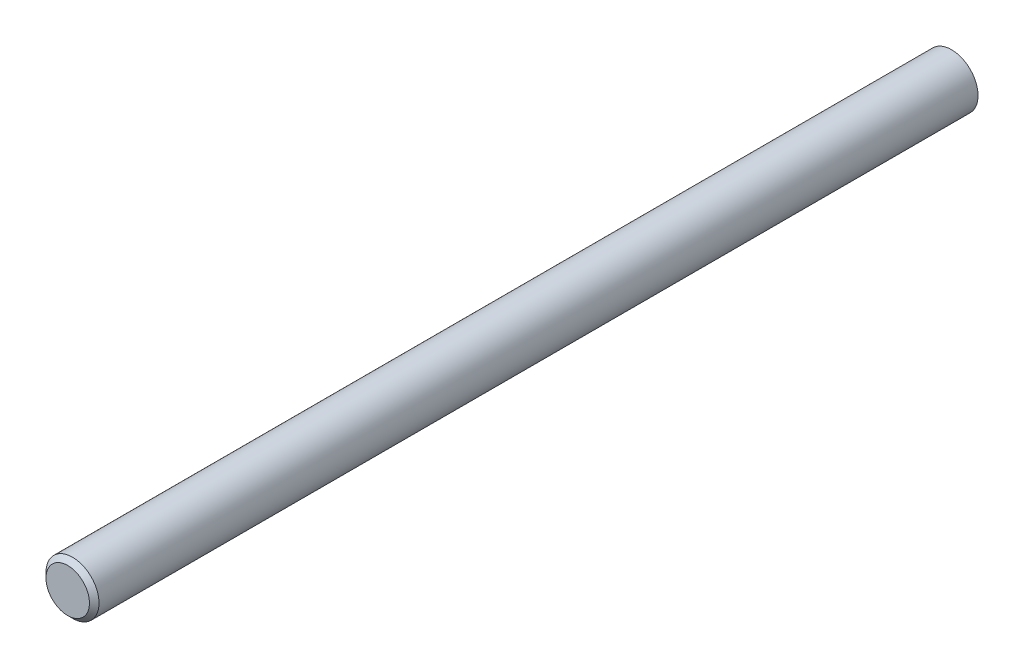
from build123d import *

# Parameters (mm, degrees)
SKETCH_1_R      = 3
EXTRUDE_1_DEPTH = 100


# Read off the part's stored shape, not the designer's step: M6 机械螺纹 螺柱1
with BuildPart() as part:
    # 草图1 → 凸台-拉伸1 (new body)
    with BuildSketch(Plane.XY):
        with Locations(Location((0, 0, 0), (0, 0, 180))):
            Circle(SKETCH_1_R)
    extrude(amount=EXTRUDE_1_DEPTH)

    # M6 机械螺纹 螺柱1 outline → M6 机械螺纹 螺柱1 (revolve, cut)
    with BuildSketch(Plane.XZ):
        Polygon((3, 100), (2.4585, 100), (3, 99.4585), align=None)
    revolve(axis=Axis((0, 0, 0), (0, 0, 1)), mode=Mode.SUBTRACT)


solid = part.part
